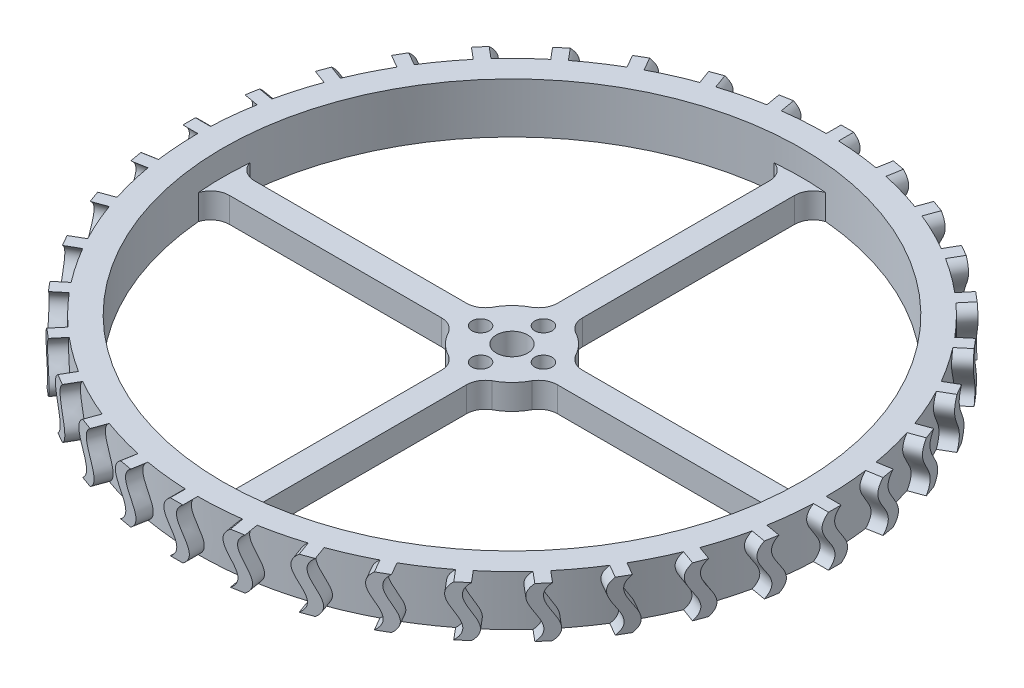
from build123d import *

# Parameters (mm, degrees)
SKETCH2_R           = 1.75
SKETCH2_R_2         = 3.175
BOSS_EXTRUDE3_DEPTH = 5.08
SKETCH2_3_R         = 63.5
BOSS_EXTRUDE4_DEPTH = 10.16
BOSS_EXTRUDE5_START = -3
BOSS_EXTRUDE5_DEPTH = 5
CIRPATTERN1_COUNT   = 36


with BuildPart() as part:
    # Sketch2 → Boss-Extrude3 (new body)
    with BuildSketch(Plane(origin=(0, 0, 0), x_dir=(1, 0, 0), z_dir=(0, 1, 0))):
        with BuildLine():
            Line((54.554756489, 2.54), (11.720088507, 2.54))
            ThreePointArc((11.720088507, 2.54), (9.843513936, 3.034194234), (8.453759486, 4.388573293))
            ThreePointArc((8.453759486, 4.388573293), (6.735192091, 6.735192091), (4.388573293, 8.453759486))
            ThreePointArc((4.388573293, 8.453759486), (3.034194234, 9.843513936), (2.54, 11.720088507))
            Line((2.54, 11.720088507), (2.54, 54.554756489))
            ThreePointArc((2.54, 54.554756489), (3.27691694, 56.806924446), (5.202603941, 58.187879427))
            ThreePointArc((5.202603941, 58.187879427), (0, 58.42), (-5.202603941, 58.187879427))
            ThreePointArc((-5.202603941, 58.187879427), (-3.27691694, 56.806924446), (-2.54, 54.554756489))
            Line((-2.54, 54.554756489), (-2.54, 11.720088507))
            ThreePointArc((-2.54, 11.720088507), (-3.034194234, 9.843513936), (-4.388573293, 8.453759486))
            ThreePointArc((-4.388573293, 8.453759486), (-6.735192091, 6.735192091), (-8.453759486, 4.388573293))
            ThreePointArc((-8.453759486, 4.388573293), (-9.843513936, 3.034194234), (-11.720088507, 2.54))
            Line((-11.720088507, 2.54), (-54.554756489, 2.54))
            ThreePointArc((-54.554756489, 2.54), (-56.806924446, 3.27691694), (-58.187879427, 5.202603941))
            ThreePointArc((-58.187879427, 5.202603941), (-58.42, 0), (-58.187879427, -5.202603941))
            ThreePointArc((-58.187879427, -5.202603941), (-56.806924446, -3.27691694), (-54.554756489, -2.54))
            Line((-54.554756489, -2.54), (-11.720088507, -2.54))
            ThreePointArc((-11.720088507, -2.54), (-9.843513936, -3.034194234), (-8.453759486, -4.388573293))
            ThreePointArc((-8.453759486, -4.388573293), (-6.735192091, -6.735192091), (-4.388573293, -8.453759486))
            ThreePointArc((-4.388573293, -8.453759486), (-3.034194234, -9.843513936), (-2.54, -11.720088507))
            Line((-2.54, -11.720088507), (-2.54, -54.554756489))
            ThreePointArc((-2.54, -54.554756489), (-3.27691694, -56.806924446), (-5.202603941, -58.187879427))
            ThreePointArc((-5.202603941, -58.187879427), (0, -58.42), (5.202603941, -58.187879427))
            ThreePointArc((5.202603941, -58.187879427), (3.27691694, -56.806924446), (2.54, -54.554756489))
            Line((2.54, -54.554756489), (2.54, -11.720088507))
            ThreePointArc((2.54, -11.720088507), (3.034194234, -9.843513936), (4.388573293, -8.453759486))
            ThreePointArc((4.388573293, -8.453759486), (6.735192091, -6.735192091), (8.453759486, -4.388573293))
            ThreePointArc((8.453759486, -4.388573293), (9.843513936, -3.034194234), (11.720088507, -2.54))
            Line((11.720088507, -2.54), (54.554756489, -2.54))
            ThreePointArc((54.554756489, -2.54), (56.806924446, -3.27691694), (58.187879427, -5.202603941))
            ThreePointArc((58.187879427, -5.202603941), (58.42, 0), (58.187879427, 5.202603941))
            ThreePointArc((58.187879427, 5.202603941), (56.806924446, 3.27691694), (54.554756489, 2.54))
        make_face()
        with Locations((0, 6.35)):
            Circle(SKETCH2_R, mode=Mode.SUBTRACT)
        with Locations((0, -6.35)):
            Circle(SKETCH2_R, mode=Mode.SUBTRACT)
        with Locations((-6.35, 0)):
            Circle(SKETCH2_R, mode=Mode.SUBTRACT)
        Circle(SKETCH2_R_2, mode=Mode.SUBTRACT)
        with Locations((6.35, 0)):
            Circle(SKETCH2_R, mode=Mode.SUBTRACT)
    extrude(amount=BOSS_EXTRUDE3_DEPTH)

    # Sketch2<3> → Boss-Extrude4 (add)
    with BuildSketch(Plane(origin=(0, 0, 0), x_dir=(1, 0, 0), z_dir=(0, 1, 0))):
        Circle(SKETCH2_3_R)
        with BuildLine():
            ThreePointArc((58.364756489, 2.54), (58.406187489, 1.270300343), (58.42, 0))
            ThreePointArc((58.42, 0), (58.406187489, -1.270300343), (58.364756489, -2.54))
            ThreePointArc((58.364756489, -2.54), (58.291522537, -3.872312013), (58.187879427, -5.202603941))
            ThreePointArc((58.187879427, -5.202603941), (41.309178157, -41.309178157), (5.202603941, -58.187879427))
            ThreePointArc((5.202603941, -58.187879427), (3.872312013, -58.291522537), (2.54, -58.364756489))
            ThreePointArc((2.54, -58.364756489), (0, -58.42), (-2.54, -58.364756489))
            ThreePointArc((-2.54, -58.364756489), (-3.872312013, -58.291522537), (-5.202603941, -58.187879427))
            ThreePointArc((-5.202603941, -58.187879427), (-41.309178157, -41.309178157), (-58.187879427, -5.202603941))
            ThreePointArc((-58.187879427, -5.202603941), (-58.291522537, -3.872312013), (-58.364756489, -2.54))
            ThreePointArc((-58.364756489, -2.54), (-58.42, 0), (-58.364756489, 2.54))
            ThreePointArc((-58.364756489, 2.54), (-58.291522537, 3.872312013), (-58.187879427, 5.202603941))
            ThreePointArc((-58.187879427, 5.202603941), (-41.309178157, 41.309178157), (-5.202603941, 58.187879427))
            ThreePointArc((-5.202603941, 58.187879427), (-3.872312013, 58.291522537), (-2.54, 58.364756489))
            ThreePointArc((-2.54, 58.364756489), (0, 58.42), (2.54, 58.364756489))
            ThreePointArc((2.54, 58.364756489), (3.872312013, 58.291522537), (5.202603941, 58.187879427))
            ThreePointArc((5.202603941, 58.187879427), (41.309178157, 41.309178157), (58.187879427, 5.202603941))
            ThreePointArc((58.187879427, 5.202603941), (58.291522537, 3.872312013), (58.364756489, 2.54))
        make_face(mode=Mode.SUBTRACT)
    extrude(amount=BOSS_EXTRUDE4_DEPTH)

    # Sketch5 → Boss-Extrude5 (add)
    with BuildSketch(Plane(origin=(0, 0, 63.5), x_dir=(-1, 0, 0), z_dir=(0, 0, -1)).offset(BOSS_EXTRUDE5_START)):
        with BuildLine():
            Line((0, 0), (2.54, 0))
            add(Edge.make_bspline(
                [(2.54, 0), (0.282222222, 1.693333333), (2.54, 5.08), (4.797777778, 8.466666667), (2.54, 10.16)],
                knots=[0, 0, 0, 0, 0.5, 1, 1, 1, 1], degree=3))
            Line((2.54, 10.16), (0, 10.16))
            add(Edge.make_bspline(
                [(0, 10.16), (4.515555556, 6.773333333), (-4.515555556, 3.386666667), (0, 0)],
                knots=[0.75, 0.75, 0.75, 0.75, 1.75, 1.75, 1.75, 1.75], degree=3))
        make_face()
    boss_extrude5 = extrude(amount=BOSS_EXTRUDE5_DEPTH)

    # CirPattern1: Boss-Extrude5 ×36 about axis
    cirpattern1_axis = Axis((0, 0, 0), (0, 1, 0))
    for i in range(1, CIRPATTERN1_COUNT):
        add(boss_extrude5.rotate(cirpattern1_axis, i * 360 / CIRPATTERN1_COUNT))


solid = part.part
